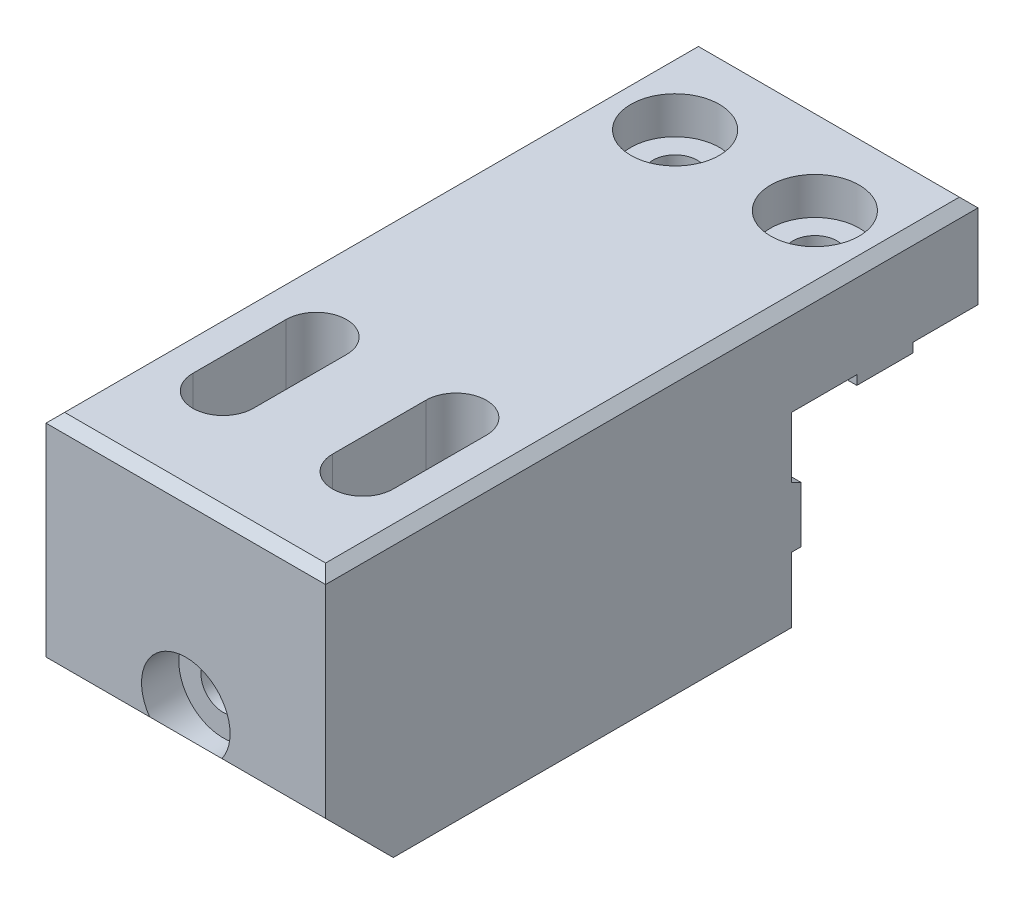
from build123d import *
from OCP.BRepFilletAPI import BRepFilletAPI_MakeChamfer

# Parameters (mm, degrees)
RESSALTO_EXTRUS_O1_DEPTH = 30
CORTE_EXTRUS_O1_REACH    = 68.527
ESBO_O2_R                = 2.375
ESBO_O2_3_R              = 4.75
ESBO_O2_3_R_2            = 2.375
CORTE_EXTRUS_O3_DEPTH    = 4
CORTE_EXTRUS_O2_REACH    = 80.086
ESBO_O3_R                = 2.375
ESBO_O3_3_R              = 2.375
CORTE_EXTRUS_O4_DEPTH    = 4
ESBO_O4_W                = 6
ESBO_O4_H                = 6
ESBO_O4_W_2              = 3
RESSALTO_EXTRUS_O2_DEPTH = 1
CORTE_EXTRUS_O5_START    = -10
CORTE_EXTRUS_O5_DEPTH    = 57.527149202
CHANFRO1_SIZE            = 1
ESBO_O6_W                = 10
ESBO_O6_H                = 6
RESSALTO_EXTRUS_O3_DEPTH = 1
CHANFRO2_SIZE            = 0.5
CHANFRO2_SIZE_2          = 1


with BuildPart() as part:
    # Esboço1 → Ressalto-extrusão1 (new body)
    with BuildSketch(Plane(origin=(0, 0, 0), x_dir=(0, 0, -1), z_dir=(1, 0, 0))):
        Polygon((51.243161309, 12.755336939), (-18.756838691, 12.755336939), (-18.756838691, -9.981327227), (-11.493502857, -17.244663061), (31.243161309, -17.244663061), (31.243161309, 2.755336939), (51.243161309, 2.755336939), align=None)
    extrude(amount=RESSALTO_EXTRUS_O1_DEPTH)

    # Esboço2 → Corte-extrusão1 (cut, up to next)
    with BuildSketch(Plane(origin=(0, 12.755336939, 0), x_dir=(1, 0, 0), z_dir=(0, 1, 0)), mode=Mode.PRIVATE) as corte_extrus_o1_sk1:
        with Locations(Location((7.5, 41.243161309, 0), (0, 0, 270))):
            Circle(ESBO_O2_R)
    corte_extrus_o1_tool1 = extrude(corte_extrus_o1_sk1.sketch, amount=-CORTE_EXTRUS_O1_REACH, mode=Mode.PRIVATE) & part.part
    # Esboço2 → Corte-extrusão1 (cut, up to next)
    with BuildSketch(Plane(origin=(0, 12.755336939, 0), x_dir=(1, 0, 0), z_dir=(0, 1, 0)), mode=Mode.PRIVATE) as corte_extrus_o1_sk2:
        with Locations(Location((22.5, 41.243161309, 0), (0, 0, 270))):
            Circle(ESBO_O2_R)
    corte_extrus_o1_tool2 = extrude(corte_extrus_o1_sk2.sketch, amount=-CORTE_EXTRUS_O1_REACH, mode=Mode.PRIVATE) & part.part
    # Esboço2 → Corte-extrusão1 (cut, up to next)
    with BuildSketch(Plane(origin=(0, 12.755336939, 0), x_dir=(1, 0, 0), z_dir=(0, 1, 0)), mode=Mode.PRIVATE) as corte_extrus_o1_sk3:
        with BuildLine():
            Line((4.25, 2.743161309), (4.25, -7.256838691))
            ThreePointArc((4.25, -7.256838691), (7.5, -10.506838691), (10.75, -7.256838691))
            Line((10.75, -7.256838691), (10.75, 2.743161309))
            ThreePointArc((10.75, 2.743161309), (7.5, 5.993161309), (4.25, 2.743161309))
        make_face()
    corte_extrus_o1_tool3 = extrude(corte_extrus_o1_sk3.sketch, amount=-CORTE_EXTRUS_O1_REACH, mode=Mode.PRIVATE) & part.part
    # Esboço2 → Corte-extrusão1 (cut, up to next)
    with BuildSketch(Plane(origin=(0, 12.755336939, 0), x_dir=(1, 0, 0), z_dir=(0, 1, 0)), mode=Mode.PRIVATE) as corte_extrus_o1_sk4:
        with BuildLine():
            Line((19.25, 2.743161309), (19.25, -7.256838691))
            ThreePointArc((19.25, -7.256838691), (22.5, -10.506838691), (25.75, -7.256838691))
            Line((25.75, -7.256838691), (25.75, 2.743161309))
            ThreePointArc((25.75, 2.743161309), (22.5, 5.993161309), (19.25, 2.743161309))
        make_face()
    corte_extrus_o1_tool4 = extrude(corte_extrus_o1_sk4.sketch, amount=-CORTE_EXTRUS_O1_REACH, mode=Mode.PRIVATE) & part.part
    add(corte_extrus_o1_tool1.solids().sort_by_distance((7.5, 12.755337, -41.243161))[0], mode=Mode.SUBTRACT)
    add(corte_extrus_o1_tool2.solids().sort_by_distance((22.5, 12.755337, -41.243161))[0], mode=Mode.SUBTRACT)
    add(corte_extrus_o1_tool3.solids().sort_by_distance((7.5, 12.755337, 2.256839))[0], mode=Mode.SUBTRACT)
    add(corte_extrus_o1_tool4.solids().sort_by_distance((22.5, 12.755337, 2.256839))[0], mode=Mode.SUBTRACT)

    # Esboço2<3> → Corte-extrusão3 (cut)
    # profile 1 of 2: a face of its own
    with BuildSketch(Plane(origin=(0, 12.755336939, 0), x_dir=(1, 0, 0), z_dir=(0, 1, 0))):
        with Locations(Location((7.5, 41.243161309, 0), (0, 0, 270))):
            Circle(ESBO_O2_3_R)
        with Locations(Location((7.5, 41.243161309, 0), (0, 0, 270))):
            Circle(ESBO_O2_3_R_2, mode=Mode.SUBTRACT)
    # profile 2 of 2: a face of its own
    with BuildSketch(Plane(origin=(0, 12.755336939, 0), x_dir=(1, 0, 0), z_dir=(0, 1, 0))):
        with Locations(Location((22.5, 41.243161309, 0), (0, 0, 270))):
            Circle(ESBO_O2_3_R)
        with Locations(Location((22.5, 41.243161309, 0), (0, 0, 270))):
            Circle(ESBO_O2_3_R_2, mode=Mode.SUBTRACT)
    extrude(amount=-CORTE_EXTRUS_O3_DEPTH, mode=Mode.SUBTRACT)

    # Esboço3 → Corte-extrusão2 (cut, up to next)
    with BuildSketch(Plane.XY.offset(18.756838691), mode=Mode.PRIVATE) as corte_extrus_o2_sk1:
        with Locations((15, -7.244663061)):
            Circle(ESBO_O3_R)
    corte_extrus_o2_tool1 = extrude(corte_extrus_o2_sk1.sketch, amount=-CORTE_EXTRUS_O2_REACH, mode=Mode.PRIVATE) & part.part
    add(corte_extrus_o2_tool1.solids().sort_by_distance((15, -7.244663, 18.756839))[0], mode=Mode.SUBTRACT)

    # Esboço3<3> → Corte-extrusão4 (cut)
    # profile 1 of 2: a face of its own
    with BuildSketch(Plane.XY.offset(18.756838691)):
        with BuildLine():
            Line((18.882417963, -9.981327227), (11.117582037, -9.981327227))
            ThreePointArc((11.117582037, -9.981327227), (15, -11.994663061), (18.882417963, -9.981327227))
        make_face()
    # profile 2 of 2: a face of its own
    with BuildSketch(Plane.XY.offset(18.756838691)):
        with BuildLine():
            ThreePointArc((18.882417963, -9.981327227), (19.527912617, -8.680109799), (19.75, -7.244663061))
            ThreePointArc((19.75, -7.244663061), (13.564553262, -2.716750444), (11.117582037, -9.981327227))
            Line((11.117582037, -9.981327227), (18.882417963, -9.981327227))
        make_face()
        with Locations((15, -7.244663061)):
            Circle(ESBO_O3_3_R, mode=Mode.SUBTRACT)
    extrude(amount=-CORTE_EXTRUS_O4_DEPTH, mode=Mode.SUBTRACT)

    # Esboço4 → Ressalto-extrusão2 (add)
    with BuildSketch(Plane.XZ.offset(-2.755336939)):
        with Locations((15, -41.243161309)):
            Rectangle(ESBO_O4_W, ESBO_O4_H)
        with Locations((1.5, -41.243161309)):
            Rectangle(ESBO_O4_W_2, ESBO_O4_H)
        with Locations((28.5, -41.243161309)):
            Rectangle(ESBO_O4_W_2, ESBO_O4_H)
    extrude(amount=RESSALTO_EXTRUS_O2_DEPTH)

    # Esboço2<4> → Corte-extrusão5 (cut, through all)
    # profile 1 of 2: a face of its own
    with BuildSketch(Plane(origin=(0, 12.755336939, 0), x_dir=(1, 0, 0), z_dir=(0, 1, 0)).offset(CORTE_EXTRUS_O5_START)):
        with BuildLine():
            Line((1, 2.743161309), (1, -7.256838691))
            ThreePointArc((1, -7.256838691), (7.5, -13.756838691), (14, -7.256838691))
            Line((14, -7.256838691), (14, 2.743161309))
            ThreePointArc((14, 2.743161309), (7.5, 9.243161309), (1, 2.743161309))
        make_face()
        with BuildLine():
            ThreePointArc((10.75, 2.743161309), (7.5, 5.993161309), (4.25, 2.743161309))
            Line((4.25, 2.743161309), (4.25, -7.256838691))
            ThreePointArc((4.25, -7.256838691), (7.5, -10.506838691), (10.75, -7.256838691))
            Line((10.75, -7.256838691), (10.75, 2.743161309))
        make_face(mode=Mode.SUBTRACT)
    # profile 2 of 2: a face of its own
    with BuildSketch(Plane(origin=(0, 12.755336939, 0), x_dir=(1, 0, 0), z_dir=(0, 1, 0)).offset(CORTE_EXTRUS_O5_START)):
        with BuildLine():
            Line((16, 2.743161309), (16, -7.256838691))
            ThreePointArc((16, -7.256838691), (22.5, -13.756838691), (29, -7.256838691))
            Line((29, -7.256838691), (29, 2.743161309))
            ThreePointArc((29, 2.743161309), (22.5, 9.243161309), (16, 2.743161309))
        make_face()
        with BuildLine():
            ThreePointArc((25.75, 2.743161309), (22.5, 5.993161309), (19.25, 2.743161309))
            Line((19.25, 2.743161309), (19.25, -7.256838691))
            ThreePointArc((19.25, -7.256838691), (22.5, -10.506838691), (25.75, -7.256838691))
            Line((25.75, -7.256838691), (25.75, 2.743161309))
        make_face(mode=Mode.SUBTRACT)
    extrude(amount=-CORTE_EXTRUS_O5_DEPTH, mode=Mode.SUBTRACT)

    # Chanfro1
    chanfro1_edges = [part.edges().sort_by_distance(p)[0] for p in [
        (0, 12.755336939, -16.243161309),
        (30, 12.755336939, -16.243161309),
        (15, 12.755336939, 18.756838691),
        (15, 12.755336939, -51.243161309),
    ]]
    chamfer(chanfro1_edges, length=CHANFRO1_SIZE)

    # Esboço6 → Ressalto-extrusão3 (add)
    with BuildSketch(Plane(origin=(0, 0, -31.243161309), x_dir=(-1, 0, 0), z_dir=(0, 0, -1))):
        with Locations((-25, -7.244663061)):
            Rectangle(ESBO_O6_W, ESBO_O6_H)
        with Locations((-5, -7.244663061)):
            Rectangle(ESBO_O6_W, ESBO_O6_H)
    extrude(amount=RESSALTO_EXTRUS_O3_DEPTH)

    # Chanfro2
    chanfro2_edges_1 = [part.edges().sort_by_distance(p)[0] for p in [
        (25, -4.244663061, -31.243161309),
    ]]
    chanfro2_side_1 = [part.faces().sort_by_distance(p)[0] for p in [
        (25, -4.234663061, -31.243161309),
    ]]
    chanfro2_edges_2 = [part.edges().sort_by_distance(p)[0] for p in [
        (5, -4.244663061, -31.243161309),
    ]]
    chanfro2_side_2 = [part.faces().sort_by_distance(p)[0] for p in [
        (5, -4.234663061, -31.243161309),
    ]]
    chanfro2 = BRepFilletAPI_MakeChamfer(part.part.solid().wrapped)
    for e in chanfro2_edges_1:
        chanfro2.Add(CHANFRO2_SIZE - 0.0001, CHANFRO2_SIZE_2 - 0.0001, e.wrapped, chanfro2_side_1[0].wrapped)
    for e in chanfro2_edges_2:
        chanfro2.Add(CHANFRO2_SIZE - 0.0001, CHANFRO2_SIZE_2 - 0.0001, e.wrapped, chanfro2_side_2[0].wrapped)
    add(Compound.cast(chanfro2.Shape()), mode=Mode.REPLACE)  # a hair under: the kernel refuses the full size


solid = part.part
